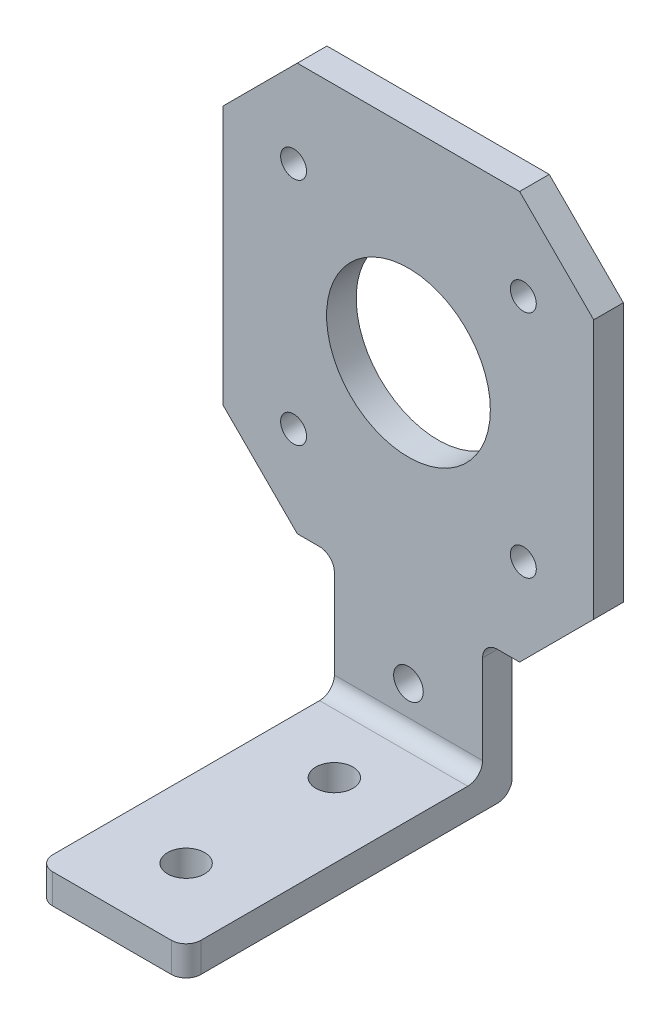
from build123d import *

# Parameters (mm, degrees)
SCHIZZO1_R                   = 1.75
SCHIZZO1_R_2                 = 11.05
ESTRUSIONE_ESTRUSIONE1_DEPTH = 4
SCHIZZO14_W                  = 20
SCHIZZO14_H                  = 4
ESTRUSIONE_ESTRUSIONE2_DEPTH = 40
SCHIZZO15_R                  = 2
TAGLIO_ESTRUSIONE1_DEPTH     = 67.942139195
SCHIZZO16_R                  = 2.5
TAGLIO_ESTRUSIONE2_DEPTH     = 88.189448903
SMUSSO1_SIZE                 = 10
RACCORDO1_R                  = 2


with BuildPart() as part:
    # Schizzo1 → Estrusione-Estrusione1 (new body)
    with BuildSketch(Plane.XY):
        Polygon((-25, -27.5), (-10, -27.5), (-10, -47.5), (10, -47.5), (10, -27.5), (25, -27.5), (25, 27.5), (-25, 27.5), align=None)
        with Locations((-15.5, 15.5)):
            Circle(SCHIZZO1_R, mode=Mode.SUBTRACT)
        with Locations((15.5, 15.5)):
            Circle(SCHIZZO1_R, mode=Mode.SUBTRACT)
        with Locations((15.5, -15.5)):
            Circle(SCHIZZO1_R, mode=Mode.SUBTRACT)
        with Locations((-15.5, -15.5)):
            Circle(SCHIZZO1_R, mode=Mode.SUBTRACT)
        Circle(SCHIZZO1_R_2, mode=Mode.SUBTRACT)
    extrude(amount=ESTRUSIONE_ESTRUSIONE1_DEPTH)

    # Schizzo14 → Estrusione-Estrusione2 (add)
    with BuildSketch(Plane.XY.offset(4)):
        with Locations((0, -45.5)):
            Rectangle(SCHIZZO14_W, SCHIZZO14_H)
    extrude(amount=ESTRUSIONE_ESTRUSIONE2_DEPTH)

    # Schizzo15 → Taglio-Estrusione1 (cut, through all)
    with BuildSketch(Plane.XY.offset(4)):
        with Locations((0, -37.5)):
            Circle(SCHIZZO15_R)
    extrude(amount=-TAGLIO_ESTRUSIONE1_DEPTH, mode=Mode.SUBTRACT)

    # Schizzo16 → Taglio-Estrusione2 (cut, through all)
    with BuildSketch(Plane(origin=(0, -43.5, 0), x_dir=(1, 0, 0), z_dir=(0, 1, 0))):
        with Locations((0, -34)):
            Circle(SCHIZZO16_R)
        with Locations((0, -14)):
            Circle(SCHIZZO16_R)
    extrude(amount=-TAGLIO_ESTRUSIONE2_DEPTH, mode=Mode.SUBTRACT)

    # Smusso1
    smusso1_edges = [part.edges().sort_by_distance(p)[0] for p in [
        (25, 27.5, 2),
        (25, -27.5, 2),
        (-25, -27.5, 2),
        (-25, 27.5, 2),
    ]]
    chamfer(smusso1_edges, length=SMUSSO1_SIZE)

    # Raccordo1
    raccordo1_edges = [part.edges().sort_by_distance(p)[0] for p in [
        (0, -47.5, 0),
        (10, -45.5, 44),
        (-10, -45.5, 44),
        (-10, -27.5, 2),
        (10, -27.5, 2),
        (0, -43.5, 4),
    ]]
    fillet(raccordo1_edges, radius=RACCORDO1_R)


solid = part.part
